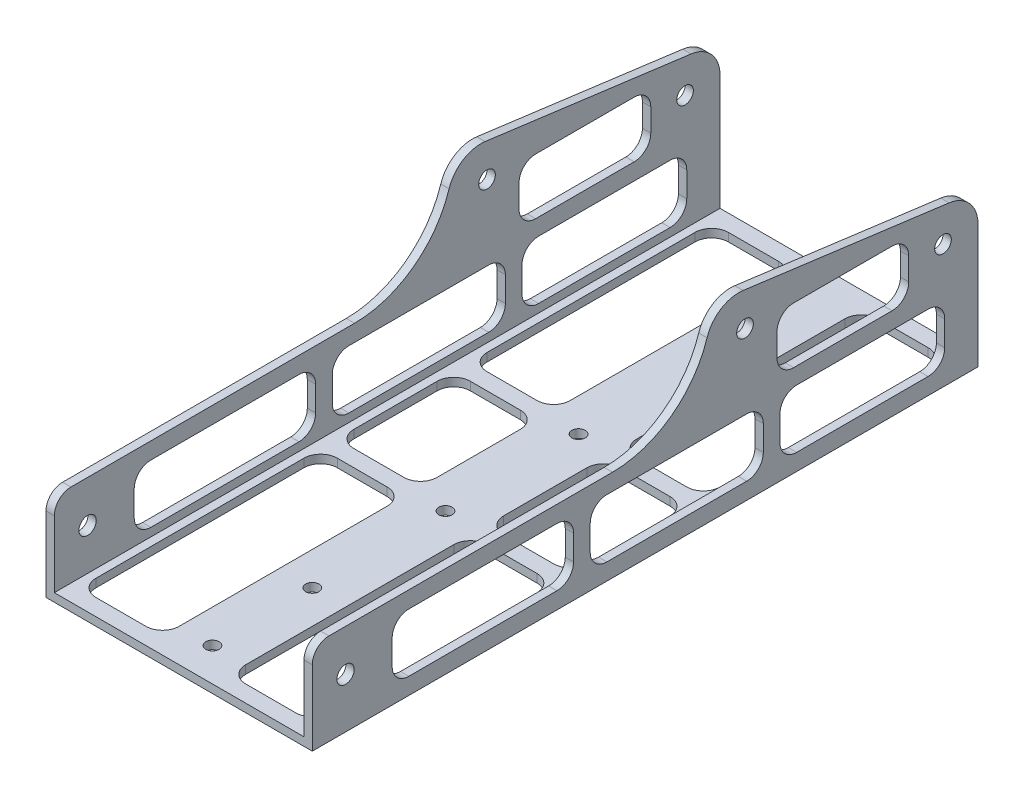
from build123d import *

# Parameters (mm, degrees)
BOSS_EXTRUDE1_DEPTH = 254
SKETCH2_R           = 3.302
SKETCH2_R_2         = 3.175
CUT_EXTRUDE1_DEPTH  = 203.2
SKETCH3_R           = 2.54
CUT_EXTRUDE2_DEPTH  = 9.525
CUT_EXTRUDE3_DEPTH  = 284.145211199
SKETCH5_R           = 3.175
CUT_EXTRUDE4_DEPTH  = 284.145211199
CUT_EXTRUDE6_DEPTH  = 284.145211199
FILLET1_R           = 12.7
FILLET2_R           = 6.35
CUT_EXTRUDE7_DEPTH  = 283.420503915
CUT_EXTRUDE8_DEPTH  = 116.332
CUT_EXTRUDE9_REACH  = 283.649
SKETCH9_R           = 2.54


with BuildPart() as part:
    # Sketch1 → Boss-Extrude1 (new body)
    with BuildSketch(Plane.XY):
        Polygon((0, 0), (0, 73.025), (3.175, 73.025), (3.175, 3.175), (98.425, 3.175), (98.425, 73.025), (101.6, 73.025), (101.6, 0), align=None)
    extrude(amount=BOSS_EXTRUDE1_DEPTH)

    # Sketch2 → Cut-Extrude1 (cut)
    with BuildSketch(Plane(origin=(101.6, 0, 0), x_dir=(0, 0, -1), z_dir=(1, 0, 0))):
        with Locations((-241.3, 19.05)):
            Circle(SKETCH2_R)
        with Locations((-88.9, 57.15)):
            Circle(SKETCH2_R_2)
    extrude(amount=-CUT_EXTRUDE1_DEPTH, mode=Mode.SUBTRACT)

    # Sketch3 → Cut-Extrude2 (cut)
    with BuildSketch(Plane(origin=(0, 3.175, 0), x_dir=(1, 0, 0), z_dir=(0, 1, 0))):
        with Locations((50.8, -50.8)):
            Circle(SKETCH3_R)
        with Locations((50.8, -101.6)):
            Circle(SKETCH3_R)
        with Locations((50.8, -152.4)):
            Circle(SKETCH3_R)
        with Locations((50.8, -203.2)):
            Circle(SKETCH3_R)
    extrude(amount=-CUT_EXTRUDE2_DEPTH, mode=Mode.SUBTRACT)

    # Sketch4 → Cut-Extrude3 (cut, through all)
    with BuildSketch(Plane(origin=(101.6, 0, 0), x_dir=(0, 0, -1), z_dir=(1, 0, 0))):
        with BuildLine():
            Line((-254, 73.025), (-101.6, 73.025))
            Line((-101.6, 73.025), (-101.6, 72.771))
            ThreePointArc((-101.6, 72.771), (-112.684836759, 46.009836759), (-139.446, 34.925))
            Line((-139.446, 34.925), (-254, 34.925))
            Line((-254, 34.925), (-254, 73.025))
        make_face()
    extrude(amount=-CUT_EXTRUDE3_DEPTH, mode=Mode.SUBTRACT)

    # Sketch5 → Cut-Extrude4 (cut, through all)
    with BuildSketch(Plane.ZY):
        with Locations((13.351901563, 47.203904153)):
            Circle(SKETCH5_R)
    extrude(amount=-CUT_EXTRUDE4_DEPTH, mode=Mode.SUBTRACT)

    # Sketch6 → Cut-Extrude6 (cut, through all)
    with BuildSketch(Plane.ZY):
        Polygon((117.259257027, 73.693154817), (117.259257027, 83.648914128), (-7.022067506, 78.935998732), (-12.481674063, 56.612437199), align=None)
    extrude(amount=-CUT_EXTRUDE6_DEPTH, mode=Mode.SUBTRACT)

    # Fillet1
    fillet1_edges = [part.edges().sort_by_distance(p)[0] for p in [
        (100.0125, 58.255680764, 0),
        (1.5875, 58.255680764, 0),
        (100.0125, 71.633824259, 101.617088473),
        (1.5875, 71.633824259, 101.617088473),
    ]]
    fillet(fillet1_edges, radius=FILLET1_R)

    # Fillet2
    fillet2_edges = [part.edges().sort_by_distance(p)[0] for p in [
        (100.0125, 34.925, 254),
        (1.5875, 34.925, 254),
    ]]
    fillet(fillet2_edges, radius=FILLET2_R)

    # Sketch7 → Cut-Extrude7 (cut, through all)
    with BuildSketch(Plane.ZY):
        with BuildLine():
            ThreePointArc((12.7, 12.7), (14.559871939, 8.209871939), (19.05, 6.35))
            Line((19.05, 6.35), (69.215, 6.35))
            ThreePointArc((69.215, 6.35), (73.705128061, 8.209871939), (75.565, 12.7))
            Line((75.565, 12.7), (75.565, 22.225))
            ThreePointArc((75.565, 22.225), (73.705128061, 26.715128061), (69.215, 28.575))
            Line((69.215, 28.575), (19.05, 28.575))
            ThreePointArc((19.05, 28.575), (14.559871939, 26.715128061), (12.7, 22.225))
            Line((12.7, 22.225), (12.7, 12.7))
        make_face()
        with BuildLine():
            ThreePointArc((223.52, 22.225), (221.660128061, 26.715128061), (217.17, 28.575))
            Line((217.17, 28.575), (160.655, 28.575))
            ThreePointArc((160.655, 28.575), (156.164871939, 26.715128061), (154.305, 22.225))
            Line((154.305, 22.225), (154.305, 12.7))
            ThreePointArc((154.305, 12.7), (156.164871939, 8.209871939), (160.655, 6.35))
            Line((160.655, 6.35), (217.17, 6.35))
            ThreePointArc((217.17, 6.35), (221.660128061, 8.209871939), (223.52, 12.7))
            Line((223.52, 12.7), (223.52, 22.225))
        make_face()
        with BuildLine():
            ThreePointArc((76.69221886, 49.938693078), (74.832346921, 54.428821139), (70.34221886, 56.288693078))
            Line((70.34221886, 56.288693078), (32.776168463, 56.288693078))
            ThreePointArc((32.776168463, 56.288693078), (28.286040403, 54.428821139), (26.426168463, 49.938693078))
            Line((26.426168463, 49.938693078), (26.426168463, 41.275))
            ThreePointArc((26.426168463, 41.275), (28.286040403, 36.784871939), (32.776168463, 34.925))
            Line((32.776168463, 34.925), (70.34221886, 34.925))
            ThreePointArc((70.34221886, 34.925), (74.832346921, 36.784871939), (76.69221886, 41.275))
            Line((76.69221886, 41.275), (76.69221886, 49.938693078))
        make_face()
        with BuildLine():
            ThreePointArc((81.915, 12.7), (83.774871939, 8.209871939), (88.265, 6.35))
            Line((88.265, 6.35), (141.605, 6.35))
            ThreePointArc((141.605, 6.35), (146.095128061, 8.209871939), (147.955, 12.7))
            Line((147.955, 12.7), (147.955, 22.225))
            ThreePointArc((147.955, 22.225), (146.095128061, 26.715128061), (141.605, 28.575))
            Line((141.605, 28.575), (88.265, 28.575))
            ThreePointArc((88.265, 28.575), (83.774871939, 26.715128061), (81.915, 22.225))
            Line((81.915, 22.225), (81.915, 12.7))
        make_face()
    extrude(amount=-CUT_EXTRUDE7_DEPTH, mode=Mode.SUBTRACT)

    # Sketch8 → Cut-Extrude8 (cut)
    with BuildSketch(Plane.XZ):
        with BuildLine():
            ThreePointArc((6.35, 12.7), (8.209871939, 8.209871939), (12.7, 6.35))
            Line((12.7, 6.35), (31.75, 6.35))
            ThreePointArc((31.75, 6.35), (36.240128061, 8.209871939), (38.1, 12.7))
            Line((38.1, 12.7), (38.1, 92.075))
            ThreePointArc((38.1, 92.075), (36.240128061, 96.565128061), (31.75, 98.425))
            Line((31.75, 98.425), (12.7, 98.425))
            ThreePointArc((12.7, 98.425), (8.209871939, 96.565128061), (6.35, 92.075))
            Line((6.35, 92.075), (6.35, 12.7))
        make_face()
        with BuildLine():
            ThreePointArc((38.1, 241.3), (36.240128061, 245.790128061), (31.75, 247.65))
            Line((31.75, 247.65), (12.7, 247.65))
            ThreePointArc((12.7, 247.65), (8.209871939, 245.790128061), (6.35, 241.3))
            Line((6.35, 241.3), (6.35, 161.925))
            ThreePointArc((6.35, 161.925), (8.209871939, 157.434871939), (12.7, 155.575))
            Line((12.7, 155.575), (31.75, 155.575))
            ThreePointArc((31.75, 155.575), (36.240128061, 157.434871939), (38.1, 161.925))
            Line((38.1, 161.925), (38.1, 241.3))
        make_face()
        with BuildLine():
            ThreePointArc((88.9, 155.575), (93.390128061, 157.434871939), (95.25, 161.925))
            Line((95.25, 161.925), (95.25, 241.3))
            ThreePointArc((95.25, 241.3), (93.390128061, 245.790128061), (88.9, 247.65))
            Line((88.9, 247.65), (69.85, 247.65))
            ThreePointArc((69.85, 247.65), (65.359871939, 245.790128061), (63.5, 241.3))
            Line((63.5, 241.3), (63.5, 161.925))
            ThreePointArc((63.5, 161.925), (65.359871939, 157.434871939), (69.85, 155.575))
            Line((69.85, 155.575), (88.9, 155.575))
        make_face()
        with BuildLine():
            ThreePointArc((88.9, 104.775), (93.390128061, 106.634871939), (95.25, 111.125))
            Line((95.25, 111.125), (95.25, 142.875))
            ThreePointArc((95.25, 142.875), (93.390128061, 147.365128061), (88.9, 149.225))
            Line((88.9, 149.225), (69.85, 149.225))
            ThreePointArc((69.85, 149.225), (65.359871939, 147.365128061), (63.5, 142.875))
            Line((63.5, 142.875), (63.5, 111.125))
            ThreePointArc((63.5, 111.125), (65.359871939, 106.634871939), (69.85, 104.775))
            Line((69.85, 104.775), (88.9, 104.775))
        make_face()
        with BuildLine():
            ThreePointArc((63.5, 12.7), (65.359871939, 8.209871939), (69.85, 6.35))
            Line((69.85, 6.35), (88.9, 6.35))
            ThreePointArc((88.9, 6.35), (93.390128061, 8.209871939), (95.25, 12.7))
            Line((95.25, 12.7), (95.25, 92.075))
            ThreePointArc((95.25, 92.075), (93.390128061, 96.565128061), (88.9, 98.425))
            Line((88.9, 98.425), (69.85, 98.425))
            ThreePointArc((69.85, 98.425), (65.359871939, 96.565128061), (63.5, 92.075))
            Line((63.5, 92.075), (63.5, 12.7))
        make_face()
        with BuildLine():
            Line((38.1, 111.125), (38.1, 142.875))
            ThreePointArc((38.1, 142.875), (36.240128061, 147.365128061), (31.75, 149.225))
            Line((31.75, 149.225), (12.7, 149.225))
            ThreePointArc((12.7, 149.225), (8.209871939, 147.365128061), (6.35, 142.875))
            Line((6.35, 142.875), (6.35, 111.125))
            ThreePointArc((6.35, 111.125), (8.209871939, 106.634871939), (12.7, 104.775))
            Line((12.7, 104.775), (31.75, 104.775))
            ThreePointArc((31.75, 104.775), (36.240128061, 106.634871939), (38.1, 111.125))
        make_face()
    extrude(amount=-CUT_EXTRUDE8_DEPTH, mode=Mode.SUBTRACT)

    # Sketch9 → Cut-Extrude9 (cut, up to next)
    with BuildSketch(Plane(origin=(0, 3.175, 0), x_dir=(1, 0, 0), z_dir=(0, 1, 0)), mode=Mode.PRIVATE) as cut_extrude9_sk1:
        with Locations((50.8, -241.3)):
            Circle(SKETCH9_R)
    cut_extrude9_tool1 = extrude(cut_extrude9_sk1.sketch, amount=-CUT_EXTRUDE9_REACH, mode=Mode.PRIVATE) & part.part
    add(cut_extrude9_tool1.solids().sort_by_distance((50.8, 3.175, 241.3))[0], mode=Mode.SUBTRACT)


solid = part.part
